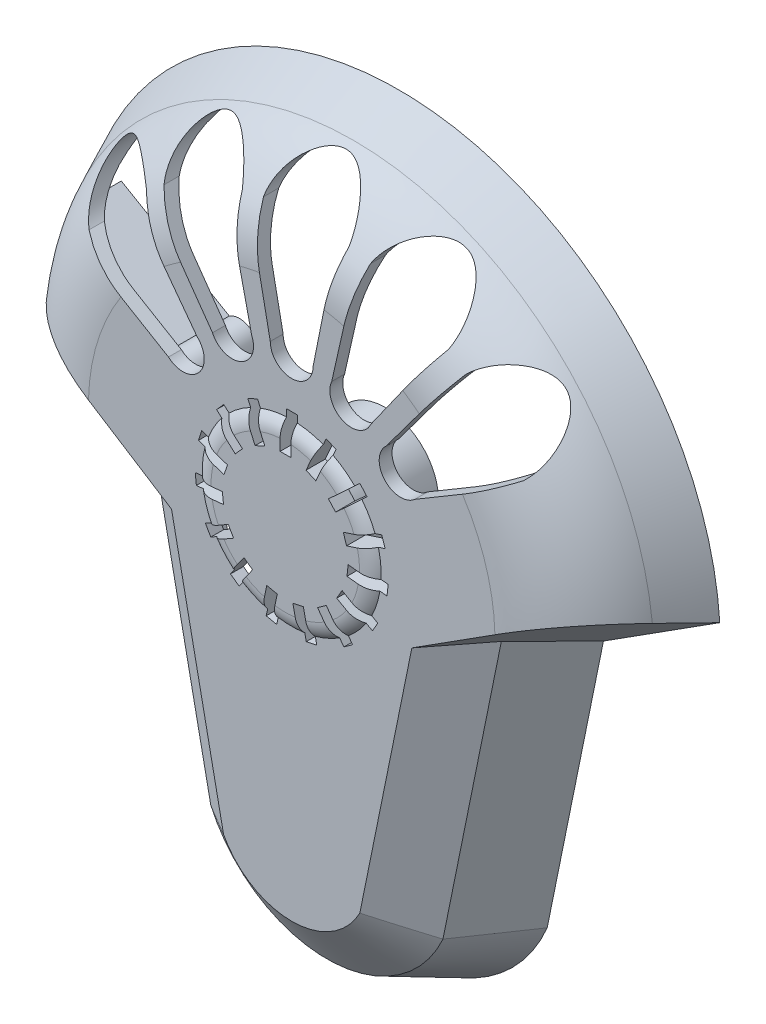
from build123d import *

# Parameters (mm, degrees)
BOSS_EXTRUDE1_DEPTH   = 12.7
BOSS_EXTRUDE1_DRAFT   = 25.000000000000053
FILLET1_R             = 12.7
CHAMFER1_SIZE         = 4.5973999999999995
CHAMFER1_SIZE2        = 4.007661149094235
CHAMFER1_PART_2_SIZE  = 4.5973999999999995
CHAMFER1_PART_2_SIZE2 = 4.007661149094235
CHAMFER1_PART_3_SIZE  = 4.5973999999999995
CHAMFER1_PART_3_SIZE2 = 4.007661149094235
SHELL2_T              = -1.524
CUT_EXTRUDE1_DEPTH    = 81.53575957872312
SKETCH3_R             = 10.6045
BOSS_EXTRUDE2_DEPTH   = 0.762
FILLET2_R             = 2.54
SKETCH5_W             = 1.27
SKETCH5_H             = 4.000000000000007
CUT_EXTRUDE2_DEPTH    = 81.65943227874048
SKETCH6_R             = 6.3500000000000005
SKETCH6_R_2           = 4.999999999999999
BOSS_EXTRUDE3_DEPTH   = 9.525
SKETCH7_R             = 2.222499999999998
SKETCH7_R_2           = 1.2700000000000005
BOSS_EXTRUDE4_DEPTH   = 9.525
BOSS_EXTRUDE6_REACH   = 82.4
SKETCH10_R            = 2.222499999999998
SKETCH10_R_2          = 1.2700000000000005
BOSS_EXTRUDE8_DEPTH   = 9.525
BOSS_EXTRUDE9_REACH   = 82.4
SKETCH12_R            = 2.2224999999999997
SKETCH12_R_2          = 1.27
BOSS_EXTRUDE10_DEPTH  = 9.525


with BuildPart() as part:
    # Sketch1 → Boss-Extrude1 (with draft: the straight prism first)
    with BuildSketch(Plane.XY):
        with BuildLine():
            ThreePointArc((-17.574017909587027, -7.35230538766681), (-3.06e-15, -19.05), (17.574017909587027, -7.35230538766681))
            Line((17.574017909587027, -7.35230538766681), (24.237549752135088, 25.4))
            Line((24.237549752135088, 25.4), (38.022309940396596, 34.18186076830443))
            ThreePointArc((38.022309940396596, 34.18186076830443), (1.079e-14, 69.85), (-38.022309940396596, 34.181860768304446))
            Line((-38.022309940396596, 34.181860768304446), (-24.237549752135088, 25.4))
            Line((-24.237549752135088, 25.4), (-17.574017909587027, -7.35230538766681))
        make_face()
    extrude(amount=BOSS_EXTRUDE1_DEPTH)
    # Boss-Extrude1: the draft: its side faces are tilted about the plane it starts from
    boss_extrude1_sides = [part.faces().sort_by_distance(p)[0] for p in [
        (0, -19.05, 6.35),
        (20.905783831, 9.023847306, 6.35),
        (31.129929846, 29.790930384, 6.35),
        (0, 69.85, 6.35),
        (-31.129929846, 29.790930384, 6.35),
        (-20.905783831, 9.023847306, 6.35),
    ]]
    draft(boss_extrude1_sides, Plane.XY, BOSS_EXTRUDE1_DRAFT)

    # Fillet1
    fillet1_edges = [part.edges().sort_by_distance(p)[0] for p in [
        (1.33e-15, 63.92789274143149, 12.7),
    ]]
    fillet(fillet1_edges, radius=FILLET1_R)

    # Chamfer1
    chamfer1_edges = [part.edges().sort_by_distance(p)[0] for p in [
        (15.41648149444763, 11.74747630684552, 12.700000000000001),
    ]]
    chamfer1_side = [part.faces().sort_by_distance(p)[0] for p in [
        (18.135126985203716, 10.393198984333075, 6.407872258576563),
    ]]
    chamfer(chamfer1_edges, length=CHAMFER1_SIZE, length2=CHAMFER1_SIZE2, reference=chamfer1_side[0])

    # Chamfer1 part 2
    chamfer1_part_2_edges = [part.edges().sort_by_distance(p)[0] for p in [
        (-15.41648149444762, 11.747476306845494, 12.700000000000001),
    ]]
    chamfer1_part_2_side = [part.faces().sort_by_distance(p)[0] for p in [
        (-18.13512698520371, 10.39319898433304, 6.407872258576554),
    ]]
    chamfer(chamfer1_part_2_edges, length=CHAMFER1_PART_2_SIZE, length2=CHAMFER1_PART_2_SIZE2, reference=chamfer1_part_2_side[0])

    # Chamfer1 part 3
    chamfer1_part_3_edges = [part.edges().sort_by_distance(p)[0] for p in [
        (2.22e-14, -13.127892741431506, 12.7),
    ]]
    chamfer1_part_3_side = [part.faces().sort_by_distance(p)[0] for p in [
        (2.398e-14, -16.088946370715753, 6.349999999999998),
    ]]
    chamfer(chamfer1_part_3_edges, length=CHAMFER1_PART_3_SIZE, length2=CHAMFER1_PART_3_SIZE2, reference=chamfer1_part_3_side[0])

    # Shell2
    shell2_openings = [part.faces().sort_by_distance(p)[0] for p in [
        (0, 30.072257734, 0),
    ]]
    offset(amount=SHELL2_T, openings=shell2_openings, kind=Kind.INTERSECTION)

    # Sketch2 → Cut-Extrude1 (cut, through all)
    with BuildSketch(Plane.XY.offset(12.7)):
        with BuildLine():
            Line((-2.54, 49.11390778293926), (-5.08, 61.81390778293926))
            ThreePointArc((-5.08, 61.81390778293926), (3.1e-16, 66.89390778293925), (5.08, 61.81390778293926))
            Line((5.08, 61.81390778293926), (2.54, 49.11390778293926))
            ThreePointArc((2.54, 49.11390778293926), (-4.7e-16, 46.57390778293926), (-2.54, 49.11390778293926))
        make_face()
        with BuildLine():
            Line((9.382943024722826, 46.57960800861723), (16.868903854197704, 57.14852424726572))
            ThreePointArc((16.868903854197704, 57.14852424726572), (14.294315076198362, 63.855557318915196), (7.587282004548883, 61.280968540915865))
            Line((7.587282004548883, 61.280968540915865), (4.742132099898412, 48.6458301554423))
            ThreePointArc((4.742132099898412, 48.6458301554423), (6.029426488898084, 45.29231361961756), (9.382943024722826, 46.57960800861723))
        make_face()
        with BuildLine():
            Line((14.60348995910948, 41.481134286844835), (25.741020982823898, 48.091505130889736))
            ThreePointArc((25.741020982823898, 48.091505130889736), (26.11701321594608, 55.265864324617894), (18.942654022217916, 55.64185655774008))
            Line((18.942654022217916, 55.64185655774008), (11.204306478806489, 45.256310000270005))
            ThreePointArc((11.204306478806489, 45.256310000270005), (11.016310362245399, 41.66913040340592), (14.60348995910948, 41.481134286844835))
        make_face()
        with BuildLine():
            Line((-11.204306478806489, 45.256310000270005), (-18.942654022217916, 55.64185655774008))
            ThreePointArc((-18.942654022217916, 55.64185655774008), (-26.11701321594608, 55.265864324617894), (-25.741020982823898, 48.091505130889736))
            Line((-25.741020982823898, 48.091505130889736), (-14.60348995910948, 41.481134286844835))
            ThreePointArc((-14.60348995910948, 41.481134286844835), (-11.016310362245399, 41.66913040340592), (-11.204306478806489, 45.256310000270005))
        make_face()
        with BuildLine():
            Line((-4.742132099898412, 48.6458301554423), (-7.587282004548883, 61.280968540915865))
            ThreePointArc((-7.587282004548883, 61.280968540915865), (-14.294315076198362, 63.855557318915196), (-16.868903854197704, 57.14852424726572))
            Line((-16.868903854197704, 57.14852424726572), (-9.382943024722826, 46.57960800861723))
            ThreePointArc((-9.382943024722826, 46.57960800861723), (-6.029426488898085, 45.29231361961756), (-4.742132099898412, 48.6458301554423))
        make_face()
    extrude(amount=-CUT_EXTRUDE1_DEPTH, mode=Mode.SUBTRACT)

    # Sketch3 → Boss-Extrude2 (add)
    with BuildSketch(Plane.XY.offset(12.7)):
        with Locations(Location((0, 31.75, 0), (0, 0, 180))):
            Circle(SKETCH3_R)
    extrude(amount=BOSS_EXTRUDE2_DEPTH)

    # Fillet2
    # the kernel refuses this fillet: 2.54 mm, written as the material it takes off along each edge
    with BuildSketch(Plane(origin=(0, 31.75, 13.462), x_dir=(-1, 0, 0), z_dir=(0, 1, 0))) as fillet2_piece_1:
        with BuildLine():
            CenterArc((8.790577179150114, -2.539999999999999), FILLET2_R, 44.42700400080565, 45.57299599919435)
            Line((8.790577179150114, 0), (8.790577179150114, 0.05080000000000062))
            Line((8.790577179150114, 0.05080000000000062), (10.6045, 0.05080000000000062))
            Line((10.6045, 0.05080000000000062), (10.6553, 0))
            ThreePointArc((10.6553, 0), (10.6553, -0.3810000000000002), (10.640778456416998, -0.7264400000000002))
            Line((10.640778456416998, -0.7264400000000002), (10.6045, -0.7620000000000005))
        make_face()
    revolve(axis=Axis((0, 31.75, 13.462), (0, 0, 1)), mode=Mode.SUBTRACT)

    # Sketch5 → Cut-Extrude2 (cut, through all)
    with BuildSketch(Plane.XY.offset(13.462)):
        with Locations((0.02463101410716523, 41.1734)):
            Rectangle(SKETCH5_W, SKETCH5_H)
        Polygon((4.088715553963818, 42.43405461319434), (5.2489182851699185, 41.91749907648807), (3.6219717128667135, 38.26331724591766), (2.4617689816606116, 38.77987278262393), align=None)
        Polygon((8.080824029725514, 39.84733912217831), (8.930619899801261, 38.90354519382202), (5.958040597891678, 36.22702276838659), (5.10824472781593, 37.17081669674288), align=None)
        Polygon((10.675684618766116, 35.860520134921124), (11.068136201622291, 34.65267835922627), (7.263910136441672, 33.4166103817265), (6.871458553585497, 34.62445215742134), align=None)
        Polygon((11.424622351672097, 31.162954873432966), (11.291871203322167, 29.89991206631526), (7.31378362184907, 30.31802591938589), (7.4465347701989995, 31.5810687265036), align=None)
        Polygon((10.198139090538314, 26.566895047465803), (9.56313909053831, 25.467042784659565), (6.099037475400561, 27.467042784659583), (6.734037475400564, 28.56689504746582), align=None)
        Polygon((7.208304933465436, 22.86704115482209), (6.1808533506092465, 22.120553884410658), (3.829712341439369, 25.35662186191046), (4.857163924295558, 26.103109132321897), align=None)
        Polygon((2.972089368001968, 20.70313154565731), (1.729841915070033, 20.43908369831877), (0.8981951517990188, 24.351674101253995), (2.140442604730954, 24.615721948592537), align=None)
        Polygon((-1.778027449773215, 20.44932584989771), (-3.0202749027051468, 20.713373697236275), (-2.1886281394340803, 24.625964100171498), (-0.9463806865021487, 24.361916252832934), align=None)
        Polygon((-6.220707168610232, 22.149509378092507), (-7.248158751466407, 22.895996648503953), (-4.897017742296485, 26.132064626003725), (-3.8695661594403097, 25.38557735559228), align=None)
        Polygon((-9.587770104643969, 25.50970495253433), (-10.22277010464396, 26.609557215340573), (-6.758668489506188, 28.609557215340544), (-6.123668489506199, 27.5097049525343), align=None)
        Polygon((-11.297020487427728, 29.948904231983757), (-11.42977163577763, 31.21194703910146), (-7.4516840543045335, 31.63006089217204), (-7.318932905954631, 30.36701808505433), align=None)
        Polygon((-11.05291339772591, 34.699529332164566), (-10.660461814869713, 35.90737110785941), (-6.856235749689108, 34.67130313035957), (-7.248687332545304, 33.46346135466474), align=None)
        Polygon((-8.897657168991289, 38.94015401518137), (-8.047861298915528, 39.88394794353765), (-5.075281997005979, 37.20742551810218), (-5.925077867081741, 36.2636315897459), align=None)
        Polygon((-5.203915183060229, 41.93753574847471), (-4.04371245185412, 42.454091285180965), (-2.4167658795509612, 38.799909454610535), (-3.5769686107570715, 38.28335391790428), align=None)
    extrude(amount=-CUT_EXTRUDE2_DEPTH, mode=Mode.SUBTRACT)

    # Sketch6 → Boss-Extrude3 (add)
    with BuildSketch(Plane(origin=(0, 0, 11.176), x_dir=(-1, 0, 0), z_dir=(0, 0, -1))):
        with Locations(Location((0, 31.75, 0), (0, 0, 180))):
            Circle(SKETCH6_R)
        with Locations(Location((0, 31.75, 0), (0, 0, 180))):
            Circle(SKETCH6_R_2, mode=Mode.SUBTRACT)
    extrude(amount=BOSS_EXTRUDE3_DEPTH)

    # Sketch7 → Boss-Extrude4 (add)
    with BuildSketch(Plane(origin=(0, 0, 11.176), x_dir=(-1, 0, 0), z_dir=(0, 0, -1))):
        with Locations(Location((-16.89186602295805, 36.378022610263294, 0), (0, 0, 180))):
            Circle(SKETCH7_R)
        with Locations(Location((-16.89186602295805, 36.378022610263294, 0), (0, 0, 180))):
            Circle(SKETCH7_R_2, mode=Mode.SUBTRACT)
    extrude(amount=BOSS_EXTRUDE4_DEPTH)

    # Sketch8 → Boss-Extrude6 (add, up to next)
    with BuildSketch(Plane(origin=(0, 0, 1.6509999999999998), x_dir=(-1, 0, 0), z_dir=(0, 0, -1)), mode=Mode.PRIVATE) as boss_extrude6_sk1:
        Polygon((-19.11436602295805, 36.378022610263294), (-18.423106643813846, 37.988863512103435), (-32.96649688371838, 42.322380844335335), (-33.44097614083451, 40.730016843468206), align=None)
    boss_extrude6_tool1 = extrude(boss_extrude6_sk1.sketch, amount=-BOSS_EXTRUDE6_REACH, mode=Mode.PRIVATE) - part.part
    # Sketch8 → Boss-Extrude6 (add, up to next)
    with BuildSketch(Plane(origin=(0, 0, 1.6509999999999998), x_dir=(-1, 0, 0), z_dir=(0, 0, -1)), mode=Mode.PRIVATE) as boss_extrude6_sk2:
        Polygon((-16.89186602295805, 34.15552261026329), (-18.839393771604204, 35.30720893914528), (-26.277671081896276, 28.251243223067497), (-24.250537522801608, 27.052481352562616), align=None)
    boss_extrude6_tool2 = extrude(boss_extrude6_sk2.sketch, amount=-BOSS_EXTRUDE6_REACH, mode=Mode.PRIVATE) - part.part
    add(boss_extrude6_tool1.solids().sort_by_distance((25.928942, 39.339526, 1.651))[0])
    add(boss_extrude6_tool2.solids().sort_by_distance((21.589564, 31.167982, 1.651))[0])

    # Sketch10 → Boss-Extrude8 (add)
    with BuildSketch(Plane(origin=(0, 0, 11.176), x_dir=(-1, 0, 0), z_dir=(0, 0, -1))):
        with Locations(Location((17.24573910698127, 36.378022610263294, 0), (0, 0, 180))):
            Circle(SKETCH10_R)
        with Locations(Location((17.24573910698127, 36.378022610263294, 0), (0, 0, 180))):
            Circle(SKETCH10_R_2, mode=Mode.SUBTRACT)
    extrude(amount=BOSS_EXTRUDE8_DEPTH)

    # Sketch11 → Boss-Extrude9 (add, up to next)
    with BuildSketch(Plane(origin=(0, 0, 1.6509999999999998), x_dir=(-1, 0, 0), z_dir=(0, 0, -1)), mode=Mode.PRIVATE) as boss_extrude9_sk1:
        Polygon((18.444375532699457, 38.2495933326624), (31.24507003194471, 45.6956085763444), (31.80200993406461, 44.374047053912456), (19.33911825819286, 37.124527787253136), align=None)
    boss_extrude9_tool1 = extrude(boss_extrude9_sk1.sketch, amount=-BOSS_EXTRUDE9_REACH, mode=Mode.PRIVATE) - part.part
    # Sketch11 → Boss-Extrude9 (add, up to next)
    with BuildSketch(Plane(origin=(0, 0, 1.6509999999999998), x_dir=(-1, 0, 0), z_dir=(0, 0, -1)), mode=Mode.PRIVATE) as boss_extrude9_sk2:
        Polygon((17.79774834295942, 34.225165891065565), (23.87127697156842, 28.151637262456713), (25.71223605841586, 29.9925963493042), (19.468239106981265, 36.378022610263294), align=None)
    boss_extrude9_tool2 = extrude(boss_extrude9_sk2.sketch, amount=-BOSS_EXTRUDE9_REACH, mode=Mode.PRIVATE) - part.part
    add(boss_extrude9_tool1.solids().sort_by_distance((-25.206026, 41.36367, 1.651))[0])
    add(boss_extrude9_tool2.solids().sort_by_distance((-21.698994, 32.212406, 1.651))[0])

    # Sketch12 → Boss-Extrude10 (add)
    with BuildSketch(Plane(origin=(0, 0, 11.176), x_dir=(-1, 0, 0), z_dir=(0, 0, -1))):
        with Locations(Location((0, 0, 0), (0, 0, 180))):
            Circle(SKETCH12_R)
        with Locations(Location((0, 0, 0), (0, 0, 180))):
            Circle(SKETCH12_R_2, mode=Mode.SUBTRACT)
    extrude(amount=BOSS_EXTRUDE10_DEPTH)


solid = part.part
